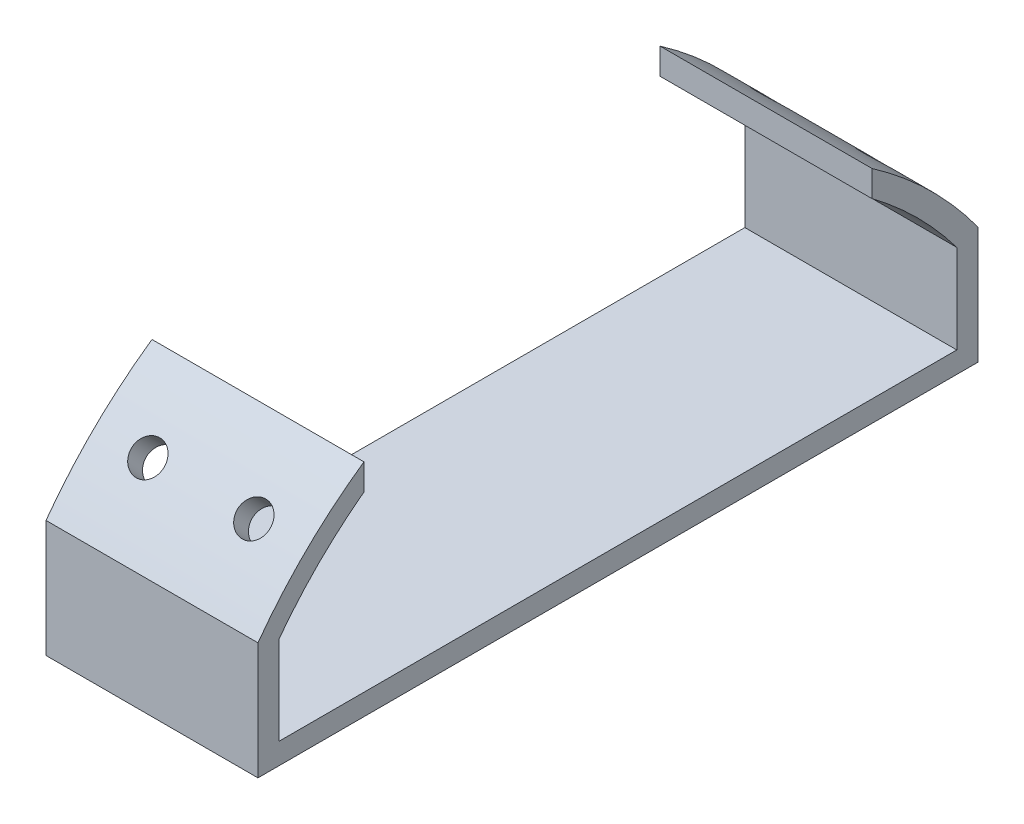
from build123d import *

# Parameters (mm, degrees)
BOSS_EXTRU_1_DEPTH         = 20
D_GAGEMENT_START           = 39.969957368
D_GAGEMENT_M2_51_OUTLINE_R = 1.55
D_GAGEMENT_M2_51_DEPTH     = 2.030042632


# Read off the part's stored shape, not the designer's step: Dégagement M2.51
with BuildPart() as part:
    # Esquisse1 → Boss.-Extru.1 (new body)
    with BuildSketch(Plane(origin=(0, 0, 0), x_dir=(0, 0, -1), z_dir=(1, 0, 0))):
        with BuildLine():
            Line((-31.97, 24.039948003), (-31.97, 15.66))
            Line((-31.97, 15.66), (31.97, 15.66))
            Line((31.97, 15.66), (31.97, 24.039948003))
            ThreePointArc((31.97, 24.039948003), (28.253337793, 28.315170908), (23.97, 32.022478043))
            Line((23.97, 32.022478043), (23.97, 34.488245824))
            ThreePointArc((23.97, 34.488245824), (29.380578316, 30.013024137), (33.97, 24.698969614))
            Line((33.97, 24.698969614), (33.97, 13.66))
            Line((33.97, 13.66), (-33.97, 13.66))
            Line((-33.97, 13.66), (-33.97, 24.698969614))
            ThreePointArc((-33.97, 24.698969614), (-29.380578316, 30.013024137), (-23.97, 34.488245824))
            Line((-23.97, 34.488245824), (-23.97, 32.022478043))
            ThreePointArc((-23.97, 32.022478043), (-28.253337793, 28.315170908), (-31.97, 24.039948003))
        make_face()
    extrude(amount=BOSS_EXTRU_1_DEPTH)

    # Dégagement M2.51 outline → Dégagement M2.51 (cut)
    with BuildSketch(Plane(origin=(0, 0, 0), x_dir=(1, 0, 0), z_dir=(0, 0.7149556691384648, -0.6991697870809138)).offset(D_GAGEMENT_START)):
        with Locations((5, 0)):
            Circle(D_GAGEMENT_M2_51_OUTLINE_R)
        with Locations((15, 0)):
            Circle(D_GAGEMENT_M2_51_OUTLINE_R)
    d_gagement_m2_51 = extrude(amount=D_GAGEMENT_M2_51_DEPTH, mode=Mode.SUBTRACT)

    # Symétrie1: Dégagement M2.51 across plane
    add(d_gagement_m2_51.mirror(Plane.XY), mode=Mode.SUBTRACT)


solid = part.part
